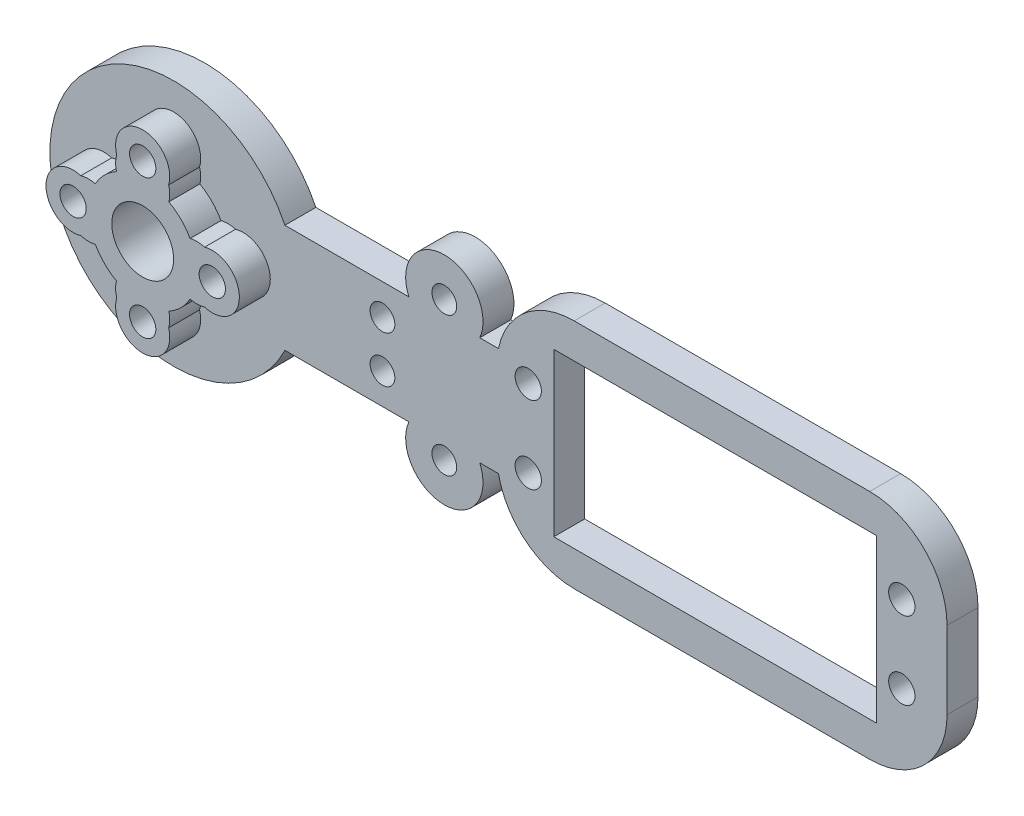
from build123d import *

# Parameters (mm, degrees)
MAIN_WEB_PROFILE_W                             = 60
MAIN_WEB_PROFILE_H                             = 14
MAIN_WEB_DEPTH                                 = 4
SHOULDER_HORN_FLANGE_PROFILE_R                 = 16
SHOULDER_HORN_FLANGE_DEPTH                     = 4
ELBOW_SERVO_MOUNT_PROFILE_W                    = 48
ELBOW_SERVO_MOUNT_PROFILE_H                    = 28
ELBOW_SERVO_MOUNT_DEPTH                        = 4
SG90_BODY_CLEARANCE_START                      = -5
SG90_BODY_CLEARANCE_PROFILE_W                  = 23.8
SG90_BODY_CLEARANCE_PROFILE_H                  = 13
SG90_BODY_CLEARANCE_DEPTH                      = 97.49863387
ELBOW_TAB_FASTENERS_START                      = -50
ELBOW_TAB_FASTENERS_PROFILE_R                  = 1.3
ELBOW_TAB_FASTENERS_DEPTH                      = 142.49863387
SHOULDER_CENTER_SCREW_ACCESS_START             = -50
SHOULDER_CENTER_SCREW_ACCESS_PROFILE_R         = 4
SHOULDER_CENTER_SCREW_ACCESS_DEPTH             = 142.49863387
CABLE_TIE_HOLES_START                          = -50
CABLE_TIE_HOLES_PROFILE_R                      = 1.6
CABLE_TIE_HOLES_DEPTH                          = 142.49863387
PASSIVE_LOWER_MOUNT_BOSS_PROFILE_R             = 5
PASSIVE_LOWER_MOUNT_BOSS_DEPTH                 = 4
PASSIVE_UPPER_MOUNT_BOSS_PROFILE_R             = 5
PASSIVE_UPPER_MOUNT_BOSS_DEPTH                 = 4
PASSIVE_CHEEK_STANDOFFS_START                  = -50
PASSIVE_CHEEK_STANDOFFS_PROFILE_R              = 1.6
PASSIVE_CHEEK_STANDOFFS_DEPTH                  = 142.49863387
SHOULDER_DOWEL_SUPPORT_HUB_START               = 4
SHOULDER_DOWEL_SUPPORT_HUB_PROFILE_R           = 7
SHOULDER_DOWEL_SUPPORT_HUB_PROFILE_R_2         = 4
SHOULDER_DOWEL_SUPPORT_HUB_DEPTH               = 4
RAISED_M3_WASHER_SEATS_HEIGHT8_START           = 4
RAISED_M3_WASHER_SEATS_PCD14_PROFILE_R         = 3.5
RAISED_M3_WASHER_SEATS_HEIGHT8_DEPTH           = 4
RESTORE_SHOULDER_SLEEVE_BORE_START             = -50
RESTORE_SHOULDER_SLEEVE_BORE_PROFILE_R         = 4
RESTORE_SHOULDER_SLEEVE_BORE_DEPTH             = 142.760557976
FILLET1_R                                      = 7.5
LARGER_ELBOW_SERVO_MOUNT_REPLACES_SG_2_W       = 58
LARGER_ELBOW_SERVO_MOUNT_REPLACES_SG_2_H       = 30
LARGER_ELBOW_SERVO_MOUNT_REPLACES_SG90_O_DEPTH = 4
FILLET2_R                                      = 10
OWNED_MG996R_ELBOW_BODY_WINDOW_START           = -5
OWNED_MG996R_ELBOW_BODY_WINDOW_PROFILE_W       = 41.698
OWNED_MG996R_ELBOW_BODY_WINDOW_PROFILE_H       = 21
OWNED_MG996R_ELBOW_BODY_WINDOW_DEPTH           = 107.587400794
OWNED_MG996R_ELBOW_M3_EAR_HOLES_START          = -50
OWNED_MG996R_ELBOW_M3_EAR_HOLES_PROFILE_R      = 1.7
OWNED_MG996R_ELBOW_M3_EAR_HOLES_DEPTH          = 152.587400794
PRINTED_HUB_M3_WASHER_SEATS_PCD18_START        = 4
PRINTED_HUB_WASHER_SEATS_PCD18_PROFILE_R       = 3.5
PRINTED_HUB_M3_WASHER_SEATS_PCD18_DEPTH        = 4
PRINTED_HUB_M3_CLEARANCE_PCD18_START           = -50
PRINTED_HUB_M3_CLEARANCE_PCD18_PROFILE_R       = 1.7
PRINTED_HUB_M3_CLEARANCE_PCD18_DEPTH           = 152.587400794


with BuildPart() as part:
    # Main_web_profile → Main_web (new body)
    with BuildSketch(Plane.XY):
        with Locations((30, 0)):
            Rectangle(MAIN_WEB_PROFILE_W, MAIN_WEB_PROFILE_H)
    extrude(amount=MAIN_WEB_DEPTH)

    # Shoulder_horn_flange_profile → Shoulder_horn_flange (add)
    with BuildSketch(Plane.XY):
        Circle(SHOULDER_HORN_FLANGE_PROFILE_R)
    extrude(amount=SHOULDER_HORN_FLANGE_DEPTH)

    # Elbow_servo_mount_profile → Elbow_servo_mount (add)
    with BuildSketch(Plane.XY):
        with Locations((66, 0)):
            Rectangle(ELBOW_SERVO_MOUNT_PROFILE_W, ELBOW_SERVO_MOUNT_PROFILE_H)
    extrude(amount=ELBOW_SERVO_MOUNT_DEPTH)

    # SG90_body_clearance_profile → SG90_body_clearance (cut, through all)
    with BuildSketch(Plane.XY.offset(SG90_BODY_CLEARANCE_START)):
        with Locations((65.5, 0)):
            Rectangle(SG90_BODY_CLEARANCE_PROFILE_W, SG90_BODY_CLEARANCE_PROFILE_H)
    extrude(amount=SG90_BODY_CLEARANCE_DEPTH, mode=Mode.SUBTRACT)

    # Elbow_tab_fasteners_profile → Elbow_tab_fasteners (cut, through all)
    with BuildSketch(Plane.XY.offset(ELBOW_TAB_FASTENERS_START)):
        with Locations(Location((51, 0, 0), (0, 0, 180))):
            Circle(ELBOW_TAB_FASTENERS_PROFILE_R)
        with Locations(Location((80, 0, 0), (0, 0, 180))):
            Circle(ELBOW_TAB_FASTENERS_PROFILE_R)
    extrude(amount=ELBOW_TAB_FASTENERS_DEPTH, mode=Mode.SUBTRACT)

    # Shoulder_center_screw_access_profile → Shoulder_center_screw_access (cut, through all)
    with BuildSketch(Plane.XY.offset(SHOULDER_CENTER_SCREW_ACCESS_START)):
        with Locations(Location((0, 0, 0), (0, 0, 180))):
            Circle(SHOULDER_CENTER_SCREW_ACCESS_PROFILE_R)
    extrude(amount=SHOULDER_CENTER_SCREW_ACCESS_DEPTH, mode=Mode.SUBTRACT)

    # Cable_tie_holes_profile → Cable_tie_holes (cut, through all)
    with BuildSketch(Plane.XY.offset(CABLE_TIE_HOLES_START)):
        with Locations(Location((27, -3, 0), (0, 0, 180))):
            Circle(CABLE_TIE_HOLES_PROFILE_R)
        with Locations(Location((27, 3, 0), (0, 0, 180))):
            Circle(CABLE_TIE_HOLES_PROFILE_R)
    extrude(amount=CABLE_TIE_HOLES_DEPTH, mode=Mode.SUBTRACT)

    # Passive_lower_mount_boss_profile → Passive_lower_mount_boss (add)
    with BuildSketch(Plane.XY):
        with Locations((35, -9)):
            Circle(PASSIVE_LOWER_MOUNT_BOSS_PROFILE_R)
    extrude(amount=PASSIVE_LOWER_MOUNT_BOSS_DEPTH)

    # Passive_upper_mount_boss_profile → Passive_upper_mount_boss (add)
    with BuildSketch(Plane.XY):
        with Locations((35, 9)):
            Circle(PASSIVE_UPPER_MOUNT_BOSS_PROFILE_R)
    extrude(amount=PASSIVE_UPPER_MOUNT_BOSS_DEPTH)

    # Passive_cheek_standoffs_profile → Passive_cheek_standoffs (cut, through all)
    with BuildSketch(Plane.XY.offset(PASSIVE_CHEEK_STANDOFFS_START)):
        with Locations(Location((35, -9, 0), (0, 0, 180))):
            Circle(PASSIVE_CHEEK_STANDOFFS_PROFILE_R)
        with Locations(Location((35, 9, 0), (0, 0, 180))):
            Circle(PASSIVE_CHEEK_STANDOFFS_PROFILE_R)
    extrude(amount=PASSIVE_CHEEK_STANDOFFS_DEPTH, mode=Mode.SUBTRACT)

    # Shoulder_dowel_support_hub_profile → Shoulder_dowel_support_hub (add)
    with BuildSketch(Plane.XY.offset(SHOULDER_DOWEL_SUPPORT_HUB_START)):
        Circle(SHOULDER_DOWEL_SUPPORT_HUB_PROFILE_R)
        with Locations(Location((0, 0, 0), (0, 0, 180))):
            Circle(SHOULDER_DOWEL_SUPPORT_HUB_PROFILE_R_2, mode=Mode.SUBTRACT)
    extrude(amount=SHOULDER_DOWEL_SUPPORT_HUB_DEPTH)

    # Raised_M3_washer_seats_PCD14_profile → Raised_M3_washer_seats_height8 (add)
    with BuildSketch(Plane.XY.offset(RAISED_M3_WASHER_SEATS_HEIGHT8_START)):
        with Locations((7, 0)):
            Circle(RAISED_M3_WASHER_SEATS_PCD14_PROFILE_R)
        with Locations((-7, 0)):
            Circle(RAISED_M3_WASHER_SEATS_PCD14_PROFILE_R)
        with Locations((0, 7)):
            Circle(RAISED_M3_WASHER_SEATS_PCD14_PROFILE_R)
        with Locations((0, -7)):
            Circle(RAISED_M3_WASHER_SEATS_PCD14_PROFILE_R)
    extrude(amount=RAISED_M3_WASHER_SEATS_HEIGHT8_DEPTH)

    # Restore_shoulder_sleeve_bore_profile → Restore_shoulder_sleeve_bore (cut, through all)
    with BuildSketch(Plane.XY.offset(RESTORE_SHOULDER_SLEEVE_BORE_START)):
        with Locations(Location((0, 0, 0), (0, 0, 180))):
            Circle(RESTORE_SHOULDER_SLEEVE_BORE_PROFILE_R)
    extrude(amount=RESTORE_SHOULDER_SLEEVE_BORE_DEPTH, mode=Mode.SUBTRACT)

    # Fillet1
    # the kernel refuses this fillet: 7.5 mm, written as the material it takes off along each edge
    with BuildSketch(Plane(origin=(42, -14, -18.708286934), x_dir=(0, 1, 0), z_dir=(0, 0, 1))) as fillet1_piece_1:
        with BuildLine():
            CenterArc((7.5, -7.483314774), FILLET1_R, 93.822553729, 86.177446271)
            Line((0, -7.483314774), (-0.15, -7.483314774))
            Line((-0.15, -7.483314774), (-0.15, 0))
            Line((-0.15, 0), (0, 0.15))
            ThreePointArc((0, 0.15), (3.5, 0.15), (6.99, 0.149666295))
            Line((6.99, 0.149666295), (7, 0))
        make_face()
    extrude(amount=41.416573868, mode=Mode.SUBTRACT)
    with BuildSketch(Plane(origin=(90, -14, -18.75), x_dir=(-1, 0, 0), z_dir=(0, 0, 1)), Plane(origin=(90, 14, -18.75), x_dir=(0, -1, 0), z_dir=(0, 0, 1))) as fillet1_piece_2:
        with BuildLine():
            CenterArc((FILLET1_R, -FILLET1_R), FILLET1_R, 90, 90)
            Line((0, -FILLET1_R), (-FILLET1_R * 0.02, -FILLET1_R))
            Line((-FILLET1_R * 0.02, -FILLET1_R), (-FILLET1_R * 0.02, FILLET1_R * 0.02))
            Line((-FILLET1_R * 0.02, FILLET1_R * 0.02), (FILLET1_R, FILLET1_R * 0.02))
            Line((FILLET1_R, FILLET1_R * 0.02), (FILLET1_R, 0))
        make_face()
    extrude(amount=41.5, mode=Mode.SUBTRACT)
    with BuildSketch(Plane(origin=(42, 14, -18.708286934), x_dir=(0, -1, 0), z_dir=(0, 0, 1))) as fillet1_piece_3:
        with BuildLine():
            CenterArc((7.5, 7.483314774), FILLET1_R, 180, 86.177446271)
            Line((0, 7.483314774), (-0.15, 7.483314774))
            Line((-0.15, 7.483314774), (-0.15, 0))
            Line((-0.15, 0), (0, -0.15))
            ThreePointArc((0, -0.15), (3.5, -0.15), (6.99, -0.149666295))
            Line((6.99, -0.149666295), (7, 0))
        make_face()
    extrude(amount=41.416573868, mode=Mode.SUBTRACT)

    # Larger_elbow_servo_mount_replaces_SG 2 → Larger_elbow_servo_mount_replaces_SG90_o (add)
    with BuildSketch(Plane.XY):
        with Locations((71, 0)):
            Rectangle(LARGER_ELBOW_SERVO_MOUNT_REPLACES_SG_2_W, LARGER_ELBOW_SERVO_MOUNT_REPLACES_SG_2_H)
    extrude(amount=LARGER_ELBOW_SERVO_MOUNT_REPLACES_SG90_O_DEPTH)

    # Fillet2
    # the kernel refuses this fillet: 10 mm, written as the material it takes off along each edge
    with BuildSketch(Plane(origin=(42, 15, -24.494897428), x_dir=(0, -1, 0), z_dir=(0, 0, 1))) as fillet2_piece_1:
        with BuildLine():
            CenterArc((10, 9.797958971), FILLET2_R, 180, 78.463040967)
            Line((0, 9.797958971), (-0.2, 9.797958971))
            Line((-0.2, 9.797958971), (-0.2, 0))
            Line((-0.2, 0), (0, -0.2))
            ThreePointArc((0, -0.2), (4, -0.2), (7.96, -0.195959179))
            Line((7.96, -0.195959179), (8, 0))
        make_face()
    extrude(amount=52.989794856, mode=Mode.SUBTRACT)
    with BuildSketch(Plane(origin=(42, -15, -24.494897428), x_dir=(0, 1, 0), z_dir=(0, 0, 1))) as fillet2_piece_2:
        with BuildLine():
            CenterArc((10, -9.797958971), FILLET2_R, 101.536959033, 78.463040967)
            Line((0, -9.797958971), (-0.2, -9.797958971))
            Line((-0.2, -9.797958971), (-0.2, 0))
            Line((-0.2, 0), (0, 0.2))
            ThreePointArc((0, 0.2), (4, 0.2), (7.96, 0.195959179))
            Line((7.96, 0.195959179), (8, 0))
        make_face()
    extrude(amount=52.989794856, mode=Mode.SUBTRACT)
    with BuildSketch(Plane(origin=(100, -15, -25), x_dir=(0, 1, 0), z_dir=(0, 0, 1)), Plane(origin=(100, 15, -25), x_dir=(-1, 0, 0), z_dir=(0, 0, 1))) as fillet2_piece_3:
        with BuildLine():
            CenterArc((FILLET2_R, FILLET2_R), FILLET2_R, 180, 90)
            Line((0, FILLET2_R), (-FILLET2_R * 0.02, FILLET2_R))
            Line((-FILLET2_R * 0.02, FILLET2_R), (-FILLET2_R * 0.02, -FILLET2_R * 0.02))
            Line((-FILLET2_R * 0.02, -FILLET2_R * 0.02), (FILLET2_R, -FILLET2_R * 0.02))
            Line((FILLET2_R, -FILLET2_R * 0.02), (FILLET2_R, 0))
        make_face()
    extrude(amount=54, mode=Mode.SUBTRACT)

    # Owned_MG996R_elbow_body_window_profile → Owned_MG996R_elbow_body_window (cut, through all)
    with BuildSketch(Plane.XY.offset(OWNED_MG996R_ELBOW_BODY_WINDOW_START)):
        with Locations((70, 0)):
            Rectangle(OWNED_MG996R_ELBOW_BODY_WINDOW_PROFILE_W, OWNED_MG996R_ELBOW_BODY_WINDOW_PROFILE_H)
    extrude(amount=OWNED_MG996R_ELBOW_BODY_WINDOW_DEPTH, mode=Mode.SUBTRACT)

    # Owned_MG996R_elbow_M3_ear_holes_profile → Owned_MG996R_elbow_M3_ear_holes (cut, through all)
    with BuildSketch(Plane.XY.offset(OWNED_MG996R_ELBOW_M3_EAR_HOLES_START)):
        with Locations(Location((45.85, -5, 0), (0, 0, 180))):
            Circle(OWNED_MG996R_ELBOW_M3_EAR_HOLES_PROFILE_R)
        with Locations(Location((45.85, 5, 0), (0, 0, 180))):
            Circle(OWNED_MG996R_ELBOW_M3_EAR_HOLES_PROFILE_R)
        with Locations(Location((94.15, -5, 0), (0, 0, 180))):
            Circle(OWNED_MG996R_ELBOW_M3_EAR_HOLES_PROFILE_R)
        with Locations(Location((94.15, 5, 0), (0, 0, 180))):
            Circle(OWNED_MG996R_ELBOW_M3_EAR_HOLES_PROFILE_R)
    extrude(amount=OWNED_MG996R_ELBOW_M3_EAR_HOLES_DEPTH, mode=Mode.SUBTRACT)

    # Printed_hub_washer_seats_PCD18_profile → Printed_hub_M3_washer_seats_PCD18 (add)
    with BuildSketch(Plane.XY.offset(PRINTED_HUB_M3_WASHER_SEATS_PCD18_START)):
        with Locations((9, 0)):
            Circle(PRINTED_HUB_WASHER_SEATS_PCD18_PROFILE_R)
        with Locations((0, 9)):
            Circle(PRINTED_HUB_WASHER_SEATS_PCD18_PROFILE_R)
        with Locations((-9, 0)):
            Circle(PRINTED_HUB_WASHER_SEATS_PCD18_PROFILE_R)
        with Locations((0, -9)):
            Circle(PRINTED_HUB_WASHER_SEATS_PCD18_PROFILE_R)
    extrude(amount=PRINTED_HUB_M3_WASHER_SEATS_PCD18_DEPTH)

    # Printed_hub_M3_clearance_PCD18_profile → Printed_hub_M3_clearance_PCD18 (cut, through all)
    with BuildSketch(Plane.XY.offset(PRINTED_HUB_M3_CLEARANCE_PCD18_START)):
        with Locations(Location((9, 0, 0), (0, 0, 180))):
            Circle(PRINTED_HUB_M3_CLEARANCE_PCD18_PROFILE_R)
        with Locations(Location((0, 9, 0), (0, 0, 180))):
            Circle(PRINTED_HUB_M3_CLEARANCE_PCD18_PROFILE_R)
        with Locations(Location((-9, 0, 0), (0, 0, 180))):
            Circle(PRINTED_HUB_M3_CLEARANCE_PCD18_PROFILE_R)
        with Locations(Location((0, -9, 0), (0, 0, 180))):
            Circle(PRINTED_HUB_M3_CLEARANCE_PCD18_PROFILE_R)
    extrude(amount=PRINTED_HUB_M3_CLEARANCE_PCD18_DEPTH, mode=Mode.SUBTRACT)


solid = part.part
